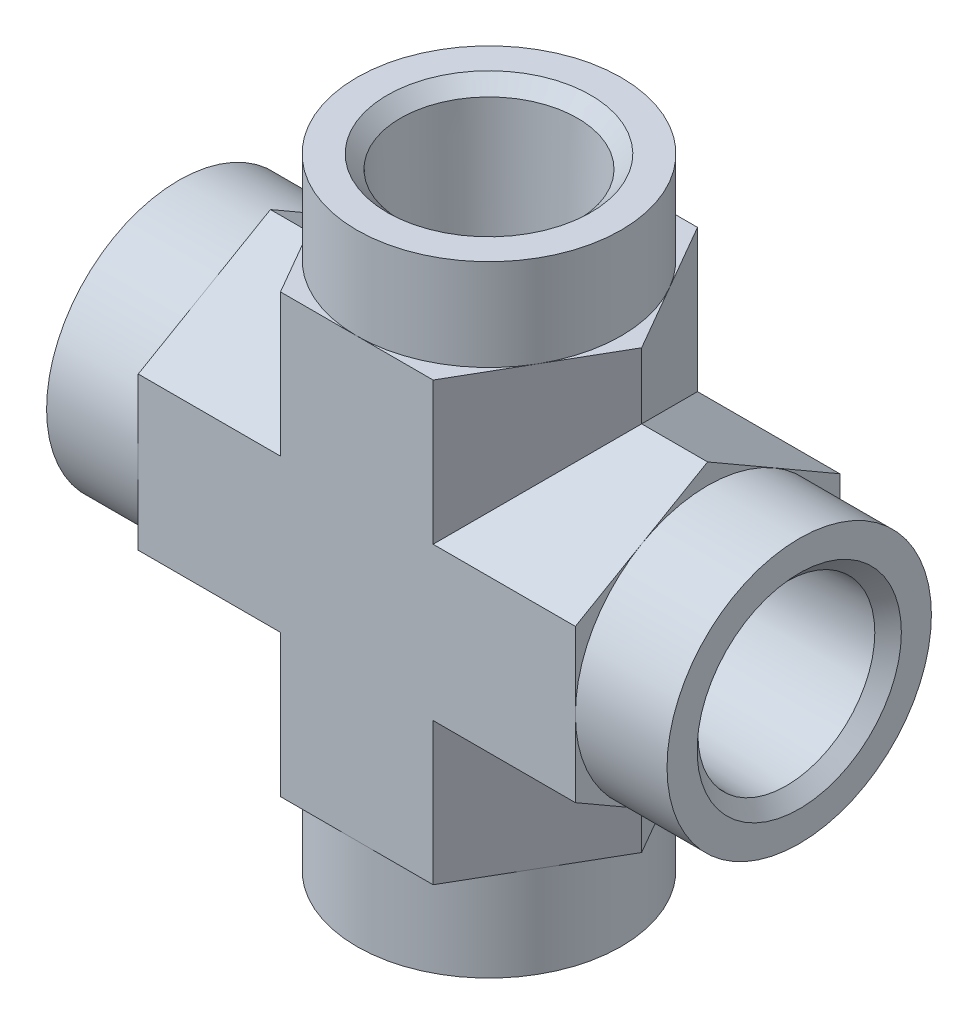
from build123d import *
from OCP.BRepFilletAPI import BRepFilletAPI_MakeChamfer

# Parameters (mm, degrees)
BOSS_EXTRUDE1_START     = -21.997045256
BOSS_EXTRUDE1_DEPTH     = 26.746522628
BOSS_EXTRUDE1_START_2   = -16.497783942
BOSS_EXTRUDE1_2_DEPTH   = 10.998522628
BOSS_EXTRUDE1_START_3   = -10.998522628
BOSS_EXTRUDE1_3_DEPTH   = 21.997045256
BOSS_EXTRUDE2_DEPTH     = 4.749477372
BOSS_EXTRUDE3_DEPTH     = 4.749477372
BOSS_EXTRUDE4_DEPTH     = 4.749477372
SKETCH5_R               = 9.525
BOSS_EXTRUDE5_DEPTH     = 6.604
SKETCH10_R              = 6.402403746
CUT_EXTRUDE2_DEPTH      = 14.224
CUT_EXTRUDE2_DRAFT      = -1.788167188
CUT_EXTRUDE3_REACH      = 32.146
CUT_EXTRUDE3_END_RADIUS = 5.5499
SKETCH11_R              = 5.5499
SKETCH12_W              = 6.604
SKETCH12_H              = 9.525
SKETCH13_W              = 9.525
SKETCH13_H              = 6.604
SKETCH14_W              = 9.525
SKETCH14_H              = 6.604
CHAMFER1_SIZE           = 0.9271
CHAMFER1_SIZE2          = 0.957442613


with BuildPart() as part:
    # Boss-Extrude1: read off the stored shape, not the designer's step
    # Boss-Extrude1 outline → Boss-Extrude1 (new body)
    with BuildSketch(Plane.ZY.offset(10.998522628).offset(BOSS_EXTRUDE1_START)):
        Polygon((-9.525, 5.499261314), (-9.525, -5.499261314), (0, -10.998522628), (9.525, -5.499261314), (9.525, 5.499261314), (0, 10.998522628), align=None)
    extrude(amount=BOSS_EXTRUDE1_DEPTH)

    # Boss-Extrude1 2 outline → Boss-Extrude1 2 (add)
    with BuildSketch(Plane.ZY.offset(10.998522628).offset(BOSS_EXTRUDE1_START_2)):
        Polygon((-9.525, -5.499261314), (-9.525, -10.998522628), (0, -10.998522628), align=None)
        Polygon((9.525, -5.499261314), (0, -10.998522628), (9.525, -10.998522628), align=None)
        Polygon((-9.525, 10.998522628), (-9.525, 5.499261314), (0, 10.998522628), align=None)
        Polygon((9.525, 10.998522628), (0, 10.998522628), (9.525, 5.499261314), align=None)
    extrude(amount=BOSS_EXTRUDE1_2_DEPTH)

    # Boss-Extrude1 3 outline → Boss-Extrude1 3 (add)
    with BuildSketch(Plane(origin=(0, 0, 0), x_dir=(1, 0, 0), z_dir=(0, 1, 0)).offset(BOSS_EXTRUDE1_START_3)):
        Polygon((10.998522628, 0), (5.499261314, 9.525), (5.499261314, -9.525), align=None)
        Polygon((-10.998522628, 0), (-5.499261314, -9.525), (-5.499261314, 9.525), align=None)
    extrude(amount=BOSS_EXTRUDE1_3_DEPTH)

    # Sketch2 → Boss-Extrude2 (add)
    with BuildSketch(Plane.XZ.offset(10.998522628)):
        Polygon((-5.499261314, -9.525), (-10.998522628, 0), (-5.499261314, 9.525), (5.499261314, 9.525), (10.998522628, 0), (5.499261314, -9.525), align=None)
    extrude(amount=BOSS_EXTRUDE2_DEPTH)

    # Sketch3 → Boss-Extrude3 (add)
    with BuildSketch(Plane(origin=(0, 10.998522628, 0), x_dir=(-1, 0, 0), z_dir=(0, 1, 0))):
        Polygon((-5.499261314, 9.525), (5.499261314, 9.525), (10.998522628, 0), (5.499261314, -9.525), (-5.499261314, -9.525), (-10.998522628, 0), align=None)
    extrude(amount=BOSS_EXTRUDE3_DEPTH)

    # Sketch4 → Boss-Extrude4 (add)
    with BuildSketch(Plane(origin=(10.998522628, 0, 0), x_dir=(0, 0, -1), z_dir=(1, 0, 0))):
        Polygon((0, 10.998522628), (9.525, 5.499261314), (9.525, -5.499261314), (0, -10.998522628), (-9.525, -5.499261314), (-9.525, 5.499261314), align=None)
    extrude(amount=BOSS_EXTRUDE4_DEPTH)

    # Sketch5 → Boss-Extrude5 (add)
    with BuildSketch(Plane(origin=(15.748, 0, 0), x_dir=(0, 0, -1), z_dir=(1, 0, 0))):
        Circle(SKETCH5_R)
    extrude(amount=BOSS_EXTRUDE5_DEPTH)


with BuildPart() as cut_extrude2_tool:
    # Sketch10 → Cut-Extrude2 (with draft: the straight prism first)
    with BuildSketch(Plane(origin=(22.352, 0, 0), x_dir=(0, 0, -1), z_dir=(1, 0, 0))):
        Circle(SKETCH10_R)
    extrude(amount=-CUT_EXTRUDE2_DEPTH)
    # Cut-Extrude2: the draft: its side faces are tilted about the plane it starts from
    cut_extrude2_sides = [cut_extrude2_tool.faces().sort_by_distance(p)[0] for p in [
        (15.24, 0, 6.402403746),
    ]]
    draft(cut_extrude2_sides, Plane(origin=(22.352, 0, 0), x_dir=(0, 0, -1), z_dir=(1, 0, 0)), CUT_EXTRUDE2_DRAFT)


with BuildPart() as part_1:
    add(part.part)

    # Cut-Extrude2: cut by cut_extrude2_tool
    add(cut_extrude2_tool.part, mode=Mode.SUBTRACT)

    # Cut-Extrude3: up to this cylinder (the profile starts outside it)
    cut_extrude3_end = Plane(origin=(0, 0, 0), z_dir=(0, 1, 0)) * Cylinder(CUT_EXTRUDE3_END_RADIUS, 76.3918, mode=Mode.PRIVATE)
    # Sketch11 → Cut-Extrude3 (cut, up to the surface)
    with BuildSketch(Plane(origin=(8.128, 0, 0), x_dir=(0, 0, -1), z_dir=(1, 0, 0)), mode=Mode.PRIVATE) as cut_extrude3_sk1:
        with Locations(Location((0, 0, 0), (0, 0, 180))):
            Circle(SKETCH11_R)
    cut_extrude3_tool1 = extrude(cut_extrude3_sk1.sketch, amount=-CUT_EXTRUDE3_REACH, mode=Mode.PRIVATE) - cut_extrude3_end
    add(cut_extrude3_tool1.solids().sort_by_distance((8.128, 0, 0))[0], mode=Mode.SUBTRACT)

    # Sketch12 → Revolve1 (revolve)
    with BuildSketch(Plane(origin=(0, 0, 0), x_dir=(-1, 0, 0), z_dir=(0, 0, -1)), mode=Mode.PRIVATE) as revolve1_sk:
        with Locations((19.05, 4.7625)):
            Rectangle(SKETCH12_W, SKETCH12_H)
    revolve(revolve1_sk.sketch.rotate(Axis((-15.748, 0, 0), (-1, 0, 0)), 270), axis=Axis((-15.748, 0, 0), (-1, 0, 0)))

    # Sketch13 → Revolve2 (revolve)
    with BuildSketch(Plane.XY, mode=Mode.PRIVATE) as revolve2_sk:
        with Locations((4.7625, -19.05)):
            Rectangle(SKETCH13_W, SKETCH13_H)
    revolve(revolve2_sk.sketch.rotate(Axis((0, -15.748, 0), (0, -1, 0)), 270), axis=Axis((0, -15.748, 0), (0, -1, 0)))

    # Sketch14 → Revolve3 (revolve)
    with BuildSketch(Plane(origin=(0, 0, 0), x_dir=(-1, 0, 0), z_dir=(0, 0, -1)), mode=Mode.PRIVATE) as revolve3_sk:
        with Locations((-4.7625, 19.05)):
            Rectangle(SKETCH14_W, SKETCH14_H)
    revolve(revolve3_sk.sketch.rotate(Axis((0, 15.748, 0), (0, 1, 0)), 270), axis=Axis((0, 15.748, 0), (0, 1, 0)))

    # Sketch15 → Cut-Revolve1 (revolve, cut)
    with BuildSketch(Plane(origin=(0, 0, 0), x_dir=(-1, 0, 0), z_dir=(0, 0, -1)), mode=Mode.PRIVATE) as cut_revolve1_sk:
        Polygon((-6.402403746, -22.352), (0, -22.352), (0, 0), (-5.5499, 0), (-5.5499, -8.128), (-5.958336981, -8.128), align=None)
    revolve(cut_revolve1_sk.sketch.rotate(Axis((0, -22.352, 0), (0, 1, 0)), 270), axis=Axis((0, -22.352, 0), (0, 1, 0)), mode=Mode.SUBTRACT)

    # Sketch16 → Cut-Revolve2 (revolve, cut)
    with BuildSketch(Plane.XY, mode=Mode.PRIVATE) as cut_revolve2_sk:
        Polygon((6.402403746, 22.352), (0, 22.352), (0, 0), (5.5499, 0), (5.5499, 8.128), (5.958336981, 8.128), align=None)
    revolve(cut_revolve2_sk.sketch.rotate(Axis((0, 22.352, 0), (0, -1, 0)), 90), axis=Axis((0, 22.352, 0), (0, -1, 0)), mode=Mode.SUBTRACT)

    # Sketch17 → Cut-Revolve3 (revolve, cut)
    with BuildSketch(Plane.XY, mode=Mode.PRIVATE) as cut_revolve3_sk:
        Polygon((-22.352, 6.402403746), (-22.352, 0), (0, 0), (0, 5.5499), (-8.128, 5.5499), (-8.128, 5.958336981), align=None)
    revolve(cut_revolve3_sk.sketch.rotate(Axis((-22.352, 0, 0), (1, 0, 0)), 270), axis=Axis((-22.352, 0, 0), (1, 0, 0)), mode=Mode.SUBTRACT)

    # Chamfer1: one chamfer whose edges measure the first distance from different faces: ONE call of the kernel's chamfer builder (chamfer() names one face for all edges)
    chamfer1_edges_1 = [part_1.edges().sort_by_distance(p)[0] for p in [
        (22.352, 0, 6.402403746),
    ]]
    chamfer1_side_1 = [part_1.faces().sort_by_distance(p)[0] for p in [
        (15.24, 0, 6.180370364),
    ]]
    chamfer1_edges_2 = [part_1.edges().sort_by_distance(p)[0] for p in [
        (0, -22.352, -6.402403746),
    ]]
    chamfer1_side_2 = [part_1.faces().sort_by_distance(p)[0] for p in [
        (0, -22.352, 9.255592316),
    ]]
    chamfer1_edges_3 = [part_1.edges().sort_by_distance(p)[0] for p in [
        (0, 22.352, -6.402403746),
    ]]
    chamfer1_side_3 = [part_1.faces().sort_by_distance(p)[0] for p in [
        (0, 22.352, -9.255592316),
    ]]
    chamfer1_edges_4 = [part_1.edges().sort_by_distance(p)[0] for p in [
        (-22.352, 0, 6.402403746),
    ]]
    chamfer1_side_4 = [part_1.faces().sort_by_distance(p)[0] for p in [
        (-22.352, 0, -9.255592316),
    ]]
    chamfer1 = BRepFilletAPI_MakeChamfer(part_1.part.solid().wrapped)
    for e in chamfer1_edges_1:
        chamfer1.Add(CHAMFER1_SIZE, CHAMFER1_SIZE2, e.wrapped, chamfer1_side_1[0].wrapped)  # the first distance lies on this face
    for e in chamfer1_edges_2:
        chamfer1.Add(CHAMFER1_SIZE, CHAMFER1_SIZE2, e.wrapped, chamfer1_side_2[0].wrapped)  # the first distance lies on this face
    for e in chamfer1_edges_3:
        chamfer1.Add(CHAMFER1_SIZE, CHAMFER1_SIZE2, e.wrapped, chamfer1_side_3[0].wrapped)  # the first distance lies on this face
    for e in chamfer1_edges_4:
        chamfer1.Add(CHAMFER1_SIZE, CHAMFER1_SIZE2, e.wrapped, chamfer1_side_4[0].wrapped)  # the first distance lies on this face
    add(Compound.cast(chamfer1.Shape()), mode=Mode.REPLACE)


solid = part_1.part
